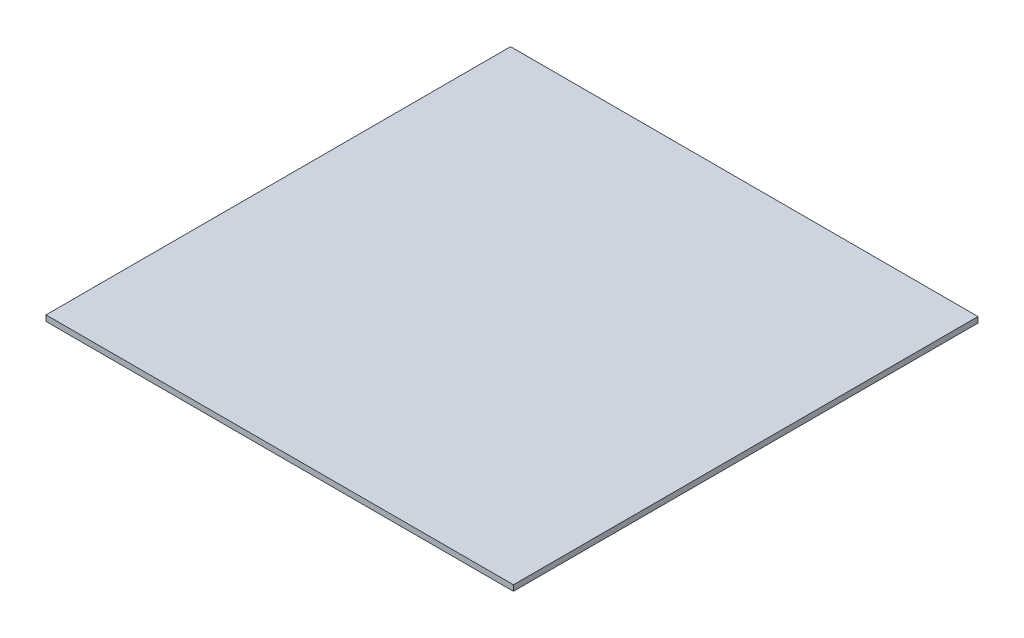
from build123d import *

# Parameters (mm, degrees)
SKETCH_1_W      = 246
SKETCH_1_H      = 244.5
EXTRUDE_1_DEPTH = 3


with BuildPart() as part:
    # 草图1 → 凸台-拉伸1 (new body)
    with BuildSketch(Plane(origin=(0, 0, 0), x_dir=(1, 0, 0), z_dir=(0, 1, 0))):
        with Locations((123, -122.25)):
            Rectangle(SKETCH_1_W, SKETCH_1_H)
    extrude(amount=EXTRUDE_1_DEPTH)


solid = part.part
